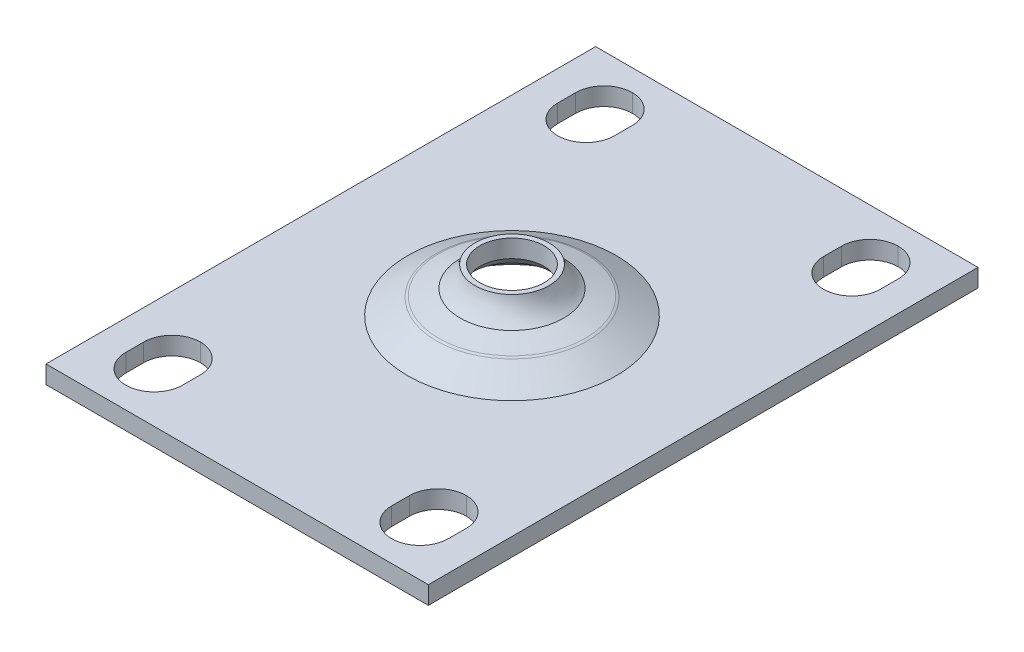
from build123d import *

# Parameters (mm, degrees)
SKETCH1_W           = 64
SKETCH1_H           = 92
BOSS_EXTRUDE1_DEPTH = 3
SKETCH2_W           = 9.5
SKETCH2_H           = 12.5
CUT_EXTRUDE1_DEPTH  = 3
FILLET1_R           = 4.75
FILLET2_R           = 2
CUT_EXTRUDE2_START  = -10.454
SKETCH6_R           = 5.375
CUT_EXTRUDE2_DEPTH  = 10.454
SKETCH8_R           = 13.356098795
CUT_EXTRUDE3_DEPTH  = 3
FILLET3_R           = 2
FILLET4_R           = 2


# Some blends are built 0.0001 mm under size
with BuildPart() as part:
    # Sketch1 → Boss-Extrude1 (new body)
    with BuildSketch(Plane(origin=(0, 0, 0), x_dir=(1, 0, 0), z_dir=(0, 1, 0))):
        Rectangle(SKETCH1_W, SKETCH1_H)
    extrude(amount=BOSS_EXTRUDE1_DEPTH)

    # Sketch2 → Cut-Extrude1 (cut)
    with BuildSketch(Plane(origin=(0, 3, 0), x_dir=(1, 0, 0), z_dir=(0, 1, 0))):
        with Locations((22.25, 36.15)):
            Rectangle(SKETCH2_W, SKETCH2_H)
        with Locations((-22.25, 36.15)):
            Rectangle(SKETCH2_W, SKETCH2_H)
        with Locations((22.25, -36.15)):
            Rectangle(SKETCH2_W, SKETCH2_H)
        with Locations((-22.25, -36.15)):
            Rectangle(SKETCH2_W, SKETCH2_H)
    extrude(amount=-CUT_EXTRUDE1_DEPTH, mode=Mode.SUBTRACT)

    # Fillet1
    fillet1_edges = [part.edges().sort_by_distance(p)[0] for p in [
        (27, 1.5, 42.4),
        (17.5, 1.5, 42.4),
        (17.5, 1.5, 29.9),
        (27, 1.5, 29.9),
        (-27, 1.5, 42.4),
        (-17.5, 1.5, 42.4),
        (-17.5, 1.5, 29.9),
        (-27, 1.5, 29.9),
        (27, 1.5, -29.9),
        (17.5, 1.5, -29.9),
        (27, 1.5, -42.4),
        (17.5, 1.5, -42.4),
        (-17.5, 1.5, -29.9),
        (-27, 1.5, -29.9),
        (-17.5, 1.5, -42.4),
        (-27, 1.5, -42.4),
    ]]
    fillet(fillet1_edges, radius=FILLET1_R - 0.0001)  # a hair under: the kernel refuses the full size

    # Sketch5 → Revolve1 (revolve)
    with BuildSketch(Plane(origin=(0, 0, 0), x_dir=(0, 0, -1), z_dir=(1, 0, 0))):
        with BuildLine():
            Line((17.443, 3), (12.48, 5.785))
            Line((12.48, 5.785), (8.652, 6.959))
            ThreePointArc((8.652, 6.959), (7.100088069, 8.476564665), (6.205, 10.454))
            Line((6.205, 10.454), (0, 10.454))
            Line((0, 10.454), (0, 3))
            Line((0, 3), (2, 3))
            Line((2, 3), (2, 8.454))
            Line((2, 8.454), (4.805757283, 8.454))
            ThreePointArc((4.805757283, 8.454), (6.064441281, 6.572314424), (7.806379809, 5.126397352))
            Line((7.806379809, 5.126397352), (11.688413221, 3.935825977))
            Line((11.688413221, 3.935825977), (13.356098795, 3))
            Line((13.356098795, 3), (17.443, 3))
        make_face()
    revolve(axis=Axis((0, -11.842752106, 0), (0, 1, 0)))

    # Fillet2
    fillet2_edges = [part.edges().sort_by_distance(p)[0] for p in [
        (0, 5.785, 12.48),
    ]]
    fillet(fillet2_edges, radius=FILLET2_R)

    # Sketch6 → Cut-Extrude2 (cut)
    with BuildSketch(Plane(origin=(0, 10.454, 0), x_dir=(1, 0, 0), z_dir=(0, 1, 0)).offset(CUT_EXTRUDE2_START)):
        with Locations(Location((0, 0, 0), (0, 0, 270))):
            Circle(SKETCH6_R)
    extrude(amount=CUT_EXTRUDE2_DEPTH, mode=Mode.SUBTRACT)

    # Sketch8 → Cut-Extrude3 (cut)
    with BuildSketch(Plane(origin=(0, 0, 0), x_dir=(-1, 0, 0), z_dir=(0, -1, 0))):
        with Locations(Location((0, 0, 0), (0, 0, 90))):
            Circle(SKETCH8_R)
    extrude(amount=-CUT_EXTRUDE3_DEPTH, mode=Mode.SUBTRACT)

    # Fillet3
    fillet3_edges = [part.edges().sort_by_distance(p)[0] for p in [
        (0, 3, 13.356098795),
    ]]
    fillet(fillet3_edges, radius=FILLET3_R)

    # Fillet4
    # the kernel refuses this fillet: 2 mm, written as the material it takes off along each edge
    with BuildSketch(Plane(origin=(0, 0, 0), x_dir=(0, 0, -1), z_dir=(-1, 0, 0))) as fillet4_piece_1:
        with BuildLine():
            CenterArc((15.352435599, -2), FILLET4_R, 90, 87.54885706)
            Line((15.352435599, 0), (15.352435599, 0.2))
            Line((15.352435599, 0.2), (13.356098795, 0.2))
            Line((13.356098795, 0.2), (13.156098795, 0))
            ThreePointArc((13.156098795, 0), (13.156095386, -1.828930112), (13.154448481, -1.905911573))
            Line((13.154448481, -1.905911573), (13.354265492, -1.914465067))
        make_face()
    revolve(axis=Axis((0, 0, 0), (0, -1, 0)), mode=Mode.SUBTRACT)


solid = part.part
